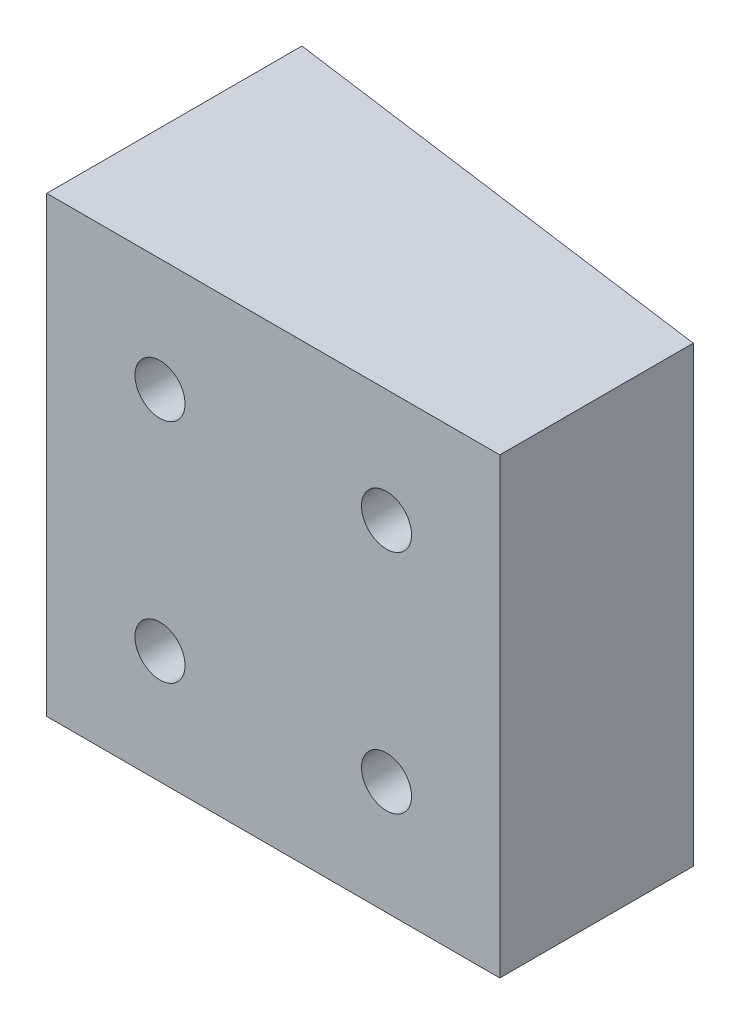
from build123d import *

# Parameters (mm, degrees)
BOSS_EXTRUDE1_DEPTH                                = 50.8
CSK_FOR_10_FLAT_HEAD_MACHINE_SCREW_100_D           = 5.6134
CSK_FOR_10_FLAT_HEAD_MACHINE_SCREW_100_CSINK_D     = 17.78
CSK_FOR_10_FLAT_HEAD_MACHINE_SCREW_100_CSINK_ANGLE = 90
CSK_FOR_10_FLAT_HEAD_MACHINE_SCREW_2_D             = 5.6134
CSK_FOR_10_FLAT_HEAD_MACHINE_SCREW_2_CSINK_D       = 17.78
CSK_FOR_10_FLAT_HEAD_MACHINE_SCREW_2_CSINK_ANGLE   = 90


with BuildPart() as part:
    # Sketch1 → Boss-Extrude1 (new body)
    with BuildSketch(Plane(origin=(0, 0, 0), x_dir=(1, 0, 0), z_dir=(0, 1, 0))):
        Polygon((0, 0), (50.8, 0), (50.8, 21.69437447), (0, 28.609796644), align=None)
    extrude(amount=BOSS_EXTRUDE1_DEPTH)

    # CSK for _10 Flat Head Machine Screw _100 (through all)
    with Locations(Plane(origin=(320.741972913, -316.395089466, -35.56), x_dir=(1, 0, 0), z_dir=(0, 0, -1))):
        with Locations((-308.041854919, -227.495089466), (-308.041854919, -252.895089466), (-308.041972913, -329.095089466), (-308.041972913, -354.495089466)):
            CounterSinkHole(CSK_FOR_10_FLAT_HEAD_MACHINE_SCREW_100_D / 2, CSK_FOR_10_FLAT_HEAD_MACHINE_SCREW_100_CSINK_D / 2, counter_sink_angle=CSK_FOR_10_FLAT_HEAD_MACHINE_SCREW_100_CSINK_ANGLE)

    # CSK for _10 Flat Head Machine Screw  2 (through all)
    with Locations(Plane(origin=(320.741972913, -316.395089466, -33.02), x_dir=(1, 0, 0), z_dir=(0, 0, -1))):
        with Locations((-282.641854919, -227.495089466), (-282.641854919, -252.895089466), (-282.641972913, -329.095089466), (-282.641972913, -354.495089466)):
            CounterSinkHole(CSK_FOR_10_FLAT_HEAD_MACHINE_SCREW_2_D / 2, CSK_FOR_10_FLAT_HEAD_MACHINE_SCREW_2_CSINK_D / 2, counter_sink_angle=CSK_FOR_10_FLAT_HEAD_MACHINE_SCREW_2_CSINK_ANGLE)


solid = part.part
